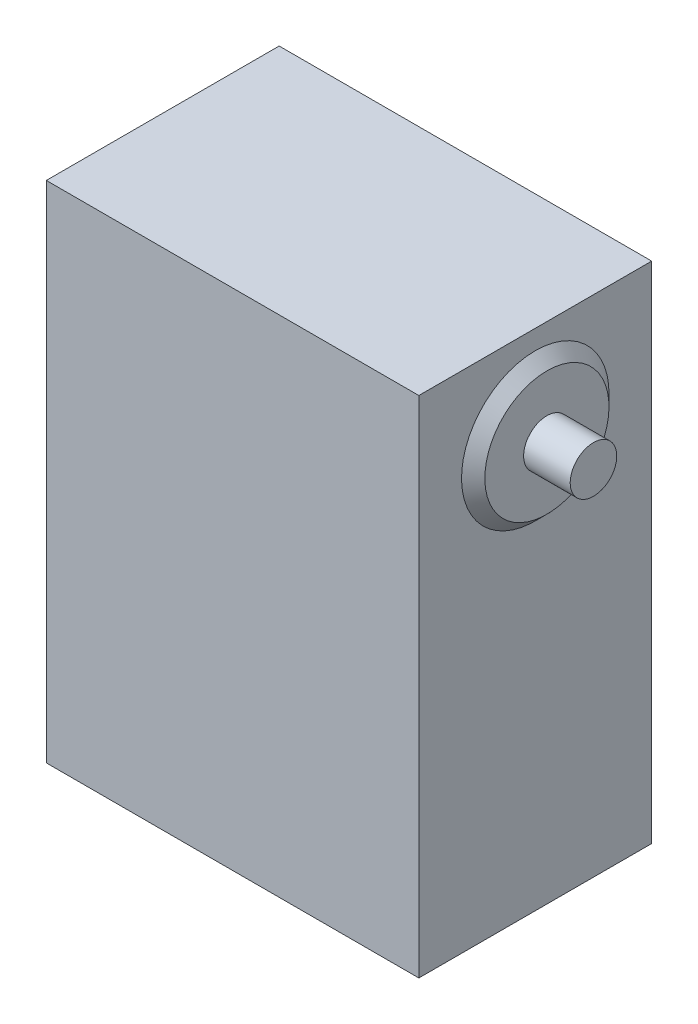
from build123d import *

# Parameters (mm, degrees)
BOSS_EXTRUDE1_DEPTH      = 15
BOSS_EXTRUDE1_DEPTH_BACK = 15
SKETCH1_W                = 48
SKETCH1_H                = 65
SKETCH2_R                = 1.25
CUT_EXTRUDE1_DEPTH       = 10
SKETCH4_R                = 9.5
SKETCH4_R_2              = 8
SKETCH4_R_3              = 3
BOSS_EXTRUDE3_DEPTH      = 1.5
CHAMFER2_SIZE            = 1.5
SKETCH5_R                = 3
BOSS_EXTRUDE4_DEPTH      = 6
CHAMFER2_OF_MIRROR1_SIZE = 1.5


with BuildPart() as part:
    # Sketch1 → Boss-Extrude1 (new, two sides: drawn at the far end of the back side and taken through both)
    with BuildSketch(Plane.XY.offset(-BOSS_EXTRUDE1_DEPTH_BACK)):
        Rectangle(SKETCH1_W, SKETCH1_H)
    extrude(amount=BOSS_EXTRUDE1_DEPTH + BOSS_EXTRUDE1_DEPTH_BACK)

    # Sketch2 → Cut-Extrude1 (cut)
    with BuildSketch(Plane.ZY.offset(24)):
        with Locations(Location((-12, 29.5, 0), (0, 0, 270))):
            Circle(SKETCH2_R)
        with Locations(Location((12, 29.5, 0), (0, 0, 270))):
            Circle(SKETCH2_R)
        with Locations(Location((12, 5.5, 0), (0, 0, 270))):
            Circle(SKETCH2_R)
        with Locations(Location((-12, 5.5, 0), (0, 0, 270))):
            Circle(SKETCH2_R)
        with Locations(Location((-12, -29.5, 0), (0, 0, 270))):
            Circle(SKETCH2_R)
        with Locations(Location((12, -29.5, 0), (0, 0, 270))):
            Circle(SKETCH2_R)
    extrude(amount=-CUT_EXTRUDE1_DEPTH, mode=Mode.SUBTRACT)

    # Sketch4 → Boss-Extrude3 (add)
    # profile 1 of 3: a face of its own
    with BuildSketch(Plane.ZY.offset(24)):
        with Locations(Location((0, 20.5, 0), (0, 0, 270))):
            Circle(SKETCH4_R)
        with Locations((0, 20.5)):
            Circle(SKETCH4_R_2, mode=Mode.SUBTRACT)
    # profile 2 of 3: a face of its own
    with BuildSketch(Plane.ZY.offset(24)):
        with Locations((0, 20.5)):
            Circle(SKETCH4_R_2)
        with Locations((0, 20.5)):
            Circle(SKETCH4_R_3, mode=Mode.SUBTRACT)
    # profile 3 of 3: a face of its own
    with BuildSketch(Plane.ZY.offset(24)):
        with Locations((0, 20.5)):
            Circle(SKETCH4_R_3)
    boss_extrude3 = extrude(amount=BOSS_EXTRUDE3_DEPTH)

    # Chamfer2
    chamfer2_edges = [part.edges().sort_by_distance(p)[0] for p in [
        (-25.5, 30, 0),
    ]]
    chamfer(chamfer2_edges, length=CHAMFER2_SIZE - 0.0001)  # a hair under: the kernel refuses the full size

    # Sketch5 → Boss-Extrude4 (add)
    with BuildSketch(Plane.ZY.offset(25.5)):
        with Locations(Location((0, 20.5, 0), (0, 0, 270))):
            Circle(SKETCH5_R)
    boss_extrude4 = extrude(amount=BOSS_EXTRUDE4_DEPTH)

    # Mirror1: Boss-Extrude3, Boss-Extrude4 across plane
    add(boss_extrude3.mirror(Plane(origin=(0, 0, 0), x_dir=(0, 0, 1), z_dir=(1, 0, 0))))
    add(boss_extrude4.mirror(Plane(origin=(0, 0, 0), x_dir=(0, 0, 1), z_dir=(1, 0, 0))))

    # Chamfer2 of Mirror1
    chamfer2_of_mirror1_edges = [part.edges().sort_by_distance(p)[0] for p in [
        (25.5, 30, 0),
    ]]
    chamfer(chamfer2_of_mirror1_edges, length=CHAMFER2_OF_MIRROR1_SIZE - 0.0001)  # a hair under: the kernel refuses the full size


solid = part.part
